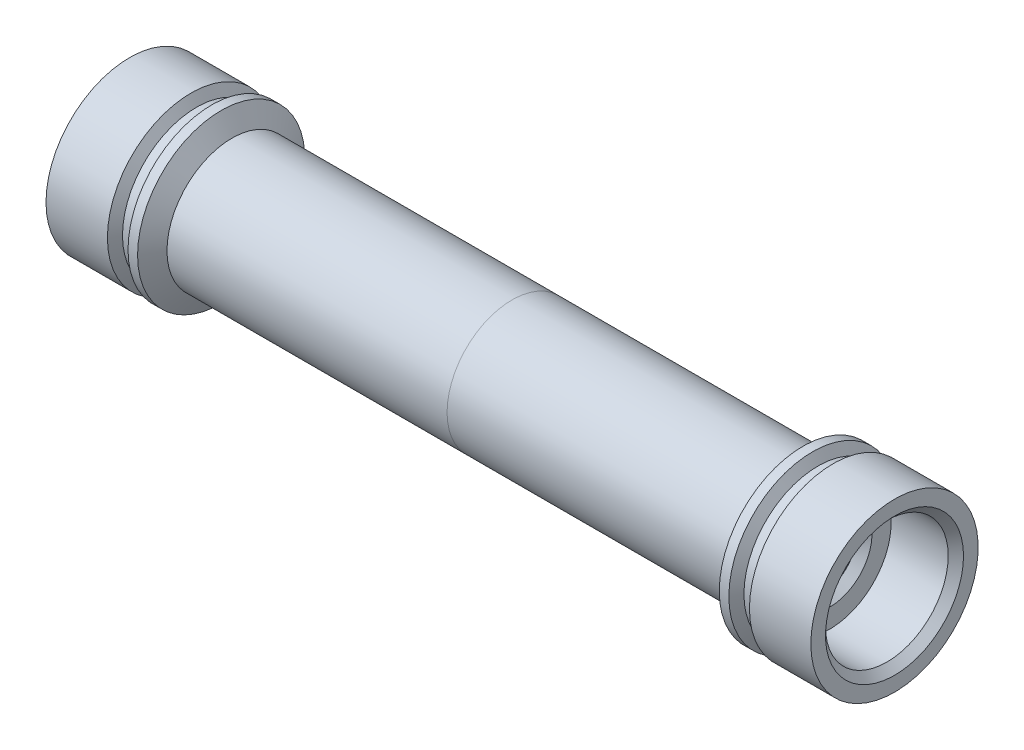
from build123d import *

# Parameters (mm, degrees)
CHAMFER1_SIZE = 0.508


with BuildPart() as part:
    # Sketch2 → Revolve1 (revolve)
    with BuildSketch(Plane.XY):
        Polygon((-21.321617421, 5.55625), (-25.4, 5.55625), (-25.4, 4.075), (-21.099999964, 4.075), (-21.099999964, 2.805), (-20.591999964, 2.297), (-20.591999964, 1.905), (-15.448, 1.905), (-15.448, 0), (-14.125000052, 0), (-12.5, 1.625000052), (0, 1.625000052), (0, 4.318), (-18.603478608, 4.318), (-19.318382579, 5.55625), (-19.953382579, 5.55625), (-20.32, 4.92125), (-20.955, 4.92125), align=None)
    revolve(axis=Axis((-25.4, 0, 0), (1, 0, 0)))

    # Chamfer1
    chamfer1_edges = [part.edges().sort_by_distance(p)[0] for p in [
        (-25.4, -4.075, 0),
    ]]
    chamfer(chamfer1_edges, length=CHAMFER1_SIZE)


with BuildPart() as body_2:
    # Mirror1: mirrored copy
    add(part.part.mirror(Plane(origin=(0, 0, 0), x_dir=(0, 0, 1), z_dir=(1, 0, 0))))


solid = Compound([part.part, body_2.part])
